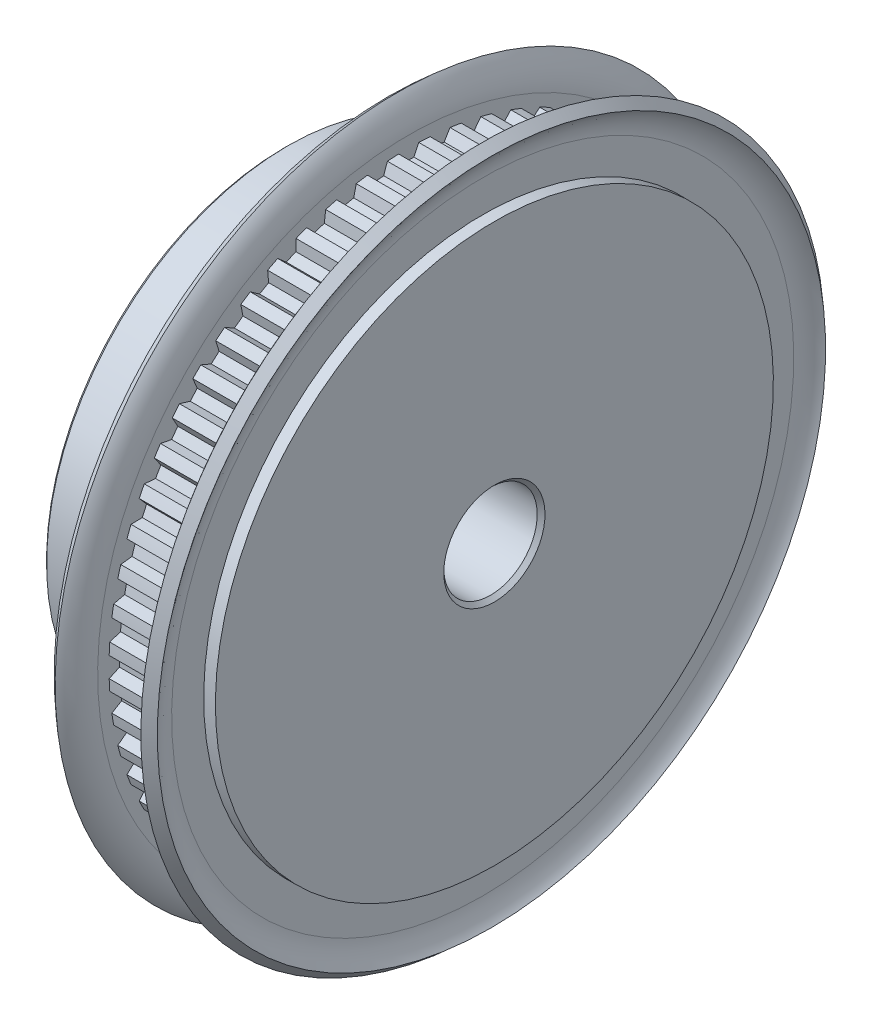
from build123d import *

# Parameters (mm, degrees)
SKETCH4_R          = 19.4
SKETCH4_R_2        = 19.24125
CUT_EXTRUDE2_DEPTH = 4
CUT_EXTRUDE1_DEPTH = 4
CIRPATTERN1_COUNT  = 60
SKETCH6_R          = 1.6
CUT_EXTRUDE3_DEPTH = 32.767396809
CUT_EXTRUDE4_DEPTH = 1.016
CIRPATTERN2_COUNT  = 2
CIRPATTERN2_ANGLE  = 90
CIRPATTERN3_COUNT  = 2
CIRPATTERN3_ANGLE  = 90
CHAMFER1_SIZE      = 0.25


with BuildPart() as part:
    # Sketch1 → Revolve1 (revolve)
    with BuildSketch(Plane.XY, mode=Mode.PRIVATE) as revolve1_sk:
        with BuildLine():
            Line((-6.75, 3), (6.75, 3))
            Line((6.75, 3), (6.75, 21.95))
            Line((6.75, 21.95), (6, 21.95))
            ThreePointArc((6, 21.95), (5.443791393, 21.029441663), (5.25, 19.9715))
            Line((5.25, 19.9715), (5.25, 19.4))
            Line((5.25, 19.4), (1.25, 19.4))
            Line((1.25, 19.4), (1.25, 19.9715))
            ThreePointArc((1.25, 19.9715), (1.056208607, 21.029441663), (0.5, 21.95))
            Line((0.5, 21.95), (-0.25, 21.95))
            Line((-0.25, 21.95), (-0.25, 15.5))
            Line((-0.25, 15.5), (-6.75, 15.5))
            Line((-6.75, 15.5), (-6.75, 3))
        make_face()
    revolve(revolve1_sk.sketch.rotate(Axis((-6.75, 0, 0), (1, 0, 0)), 180), axis=Axis((-6.75, 0, 0), (1, 0, 0)))

    # Sketch4 → Cut-Extrude2 (cut)
    with BuildSketch(Plane(origin=(1.25, 0, 0), x_dir=(0, 0, -1), z_dir=(1, 0, 0))):
        Circle(SKETCH4_R)
        with Locations(Location((0, 0, 0), (0, 0, 90))):
            Circle(SKETCH4_R_2, mode=Mode.SUBTRACT)
    extrude(amount=CUT_EXTRUDE2_DEPTH, mode=Mode.SUBTRACT)

    # Sketch3 → Cut-Extrude1 (cut)
    with BuildSketch(Plane(origin=(1.25, 0, 0), x_dir=(0, 0, -1), z_dir=(1, 0, 0))):
        with BuildLine():
            Line((-0.644483371, 19.230453524), (-0.337180019, 18.57143936))
            Line((-0.337180019, 18.57143936), (0.337180019, 18.57143936))
            Line((0.337180019, 18.57143936), (0.644483371, 19.230453524))
            ThreePointArc((0.644483371, 19.230453524), (0, 19.24125), (-0.644483371, 19.230453524))
        make_face()
    cut_extrude1 = extrude(amount=CUT_EXTRUDE1_DEPTH, mode=Mode.SUBTRACT)

    # CirPattern1: Cut-Extrude1 ×60 about axis
    cirpattern1_axis = Axis((0, 0, 0), (1, 0, 0))
    for i in range(1, CIRPATTERN1_COUNT):
        add(cut_extrude1.rotate(cirpattern1_axis, i * 360 / CIRPATTERN1_COUNT), mode=Mode.SUBTRACT)

    # Sketch6 → Cut-Extrude3 (cut, through all)
    with BuildSketch(Plane(origin=(0, 0, 0), x_dir=(1, 0, 0), z_dir=(0, 1, 0))):
        with Locations(Location((-3.5, 0, 0), (0, 0, 90))):
            Circle(SKETCH6_R)
    cut_extrude3 = extrude(amount=CUT_EXTRUDE3_DEPTH, mode=Mode.SUBTRACT)

    # CirPattern2: Cut-Extrude3 ×2 about axis
    cirpattern2_axis = Axis((-6.75, 0, 0), (1, 0, 0))
    for i in range(1, CIRPATTERN2_COUNT):
        add(cut_extrude3.rotate(cirpattern2_axis, i * CIRPATTERN2_ANGLE / (CIRPATTERN2_COUNT - 1)), mode=Mode.SUBTRACT)

    # Chamfer1
    chamfer1_edges = [part.edges().sort_by_distance(p)[0] for p in [
        (6.75, 3, 0),
        (-6.75, 3, 0),
        (-6.75, 15.5, 0),
    ]]
    chamfer(chamfer1_edges, length=CHAMFER1_SIZE)

    # Sketch9 → Cut-Revolve1 (revolve, cut)
    with BuildSketch(Plane.XY, mode=Mode.PRIVATE) as cut_revolve1_sk:
        with BuildLine():
            Line((6, 21.95), (6.561535154, 21.452829737))
            ThreePointArc((6.561535154, 21.452829737), (6.14509424, 20.763595247), (6, 19.9715))
            Line((6, 19.9715), (6, 17.912425195))
            Line((6, 17.912425195), (6.75, 17.912425195))
            Line((6.75, 17.912425195), (6.75, 21.95))
            Line((6.75, 21.95), (6.329571027, 22.322238107))
            Line((6.329571027, 22.322238107), (6, 21.95))
        make_face()
    cut_revolve1 = revolve(cut_revolve1_sk.sketch.rotate(Axis((-6.75, 0, 0), (1, 0, 0)), 180), axis=Axis((-6.75, 0, 0), (1, 0, 0)), mode=Mode.SUBTRACT)

    # Mirror1: Cut-Revolve1 across plane
    add(cut_revolve1.mirror(Plane(origin=(3.25, 0, 0), x_dir=(0, 0, 1), z_dir=(1, 0, 0))), mode=Mode.SUBTRACT)


with BuildPart() as body_2:
    # Sketch7 → Revolve2 (revolve)
    with BuildSketch(Plane.XY, mode=Mode.PRIVATE) as revolve2_sk:
        Polygon((-4.746, 15.5), (-3.5, 15.5), (-3.5, 3.381), (-4.746, 3.381), (-5, 3.635), (-5, 15.246), align=None)
    revolve(revolve2_sk.sketch.rotate(Axis((-3.5, 3.381, 0), (0, 1, 0)), 270), axis=Axis((-3.5, 3.381, 0), (0, 1, 0)))

    # Sketch8 → Cut-Extrude4 (cut)
    with BuildSketch(Plane(origin=(0, 15.5, 0), x_dir=(1, 0, 0), z_dir=(0, 1, 0))):
        Polygon((-3.5, 0.866025404), (-4.25, 0.433012702), (-4.25, -0.433012702), (-3.5, -0.866025404), (-2.75, -0.433012702), (-2.75, 0.433012702), align=None)
    extrude(amount=-CUT_EXTRUDE4_DEPTH, mode=Mode.SUBTRACT)


with BuildPart() as cirpattern3_1:
    # CirPattern3: pattern copy
    add(body_2.part.rotate(Axis((0, 0, 0), (1, 0, 0)), 1 * CIRPATTERN3_ANGLE / (CIRPATTERN3_COUNT - 1)))


solid = Compound([part.part, body_2.part, cirpattern3_1.part])
